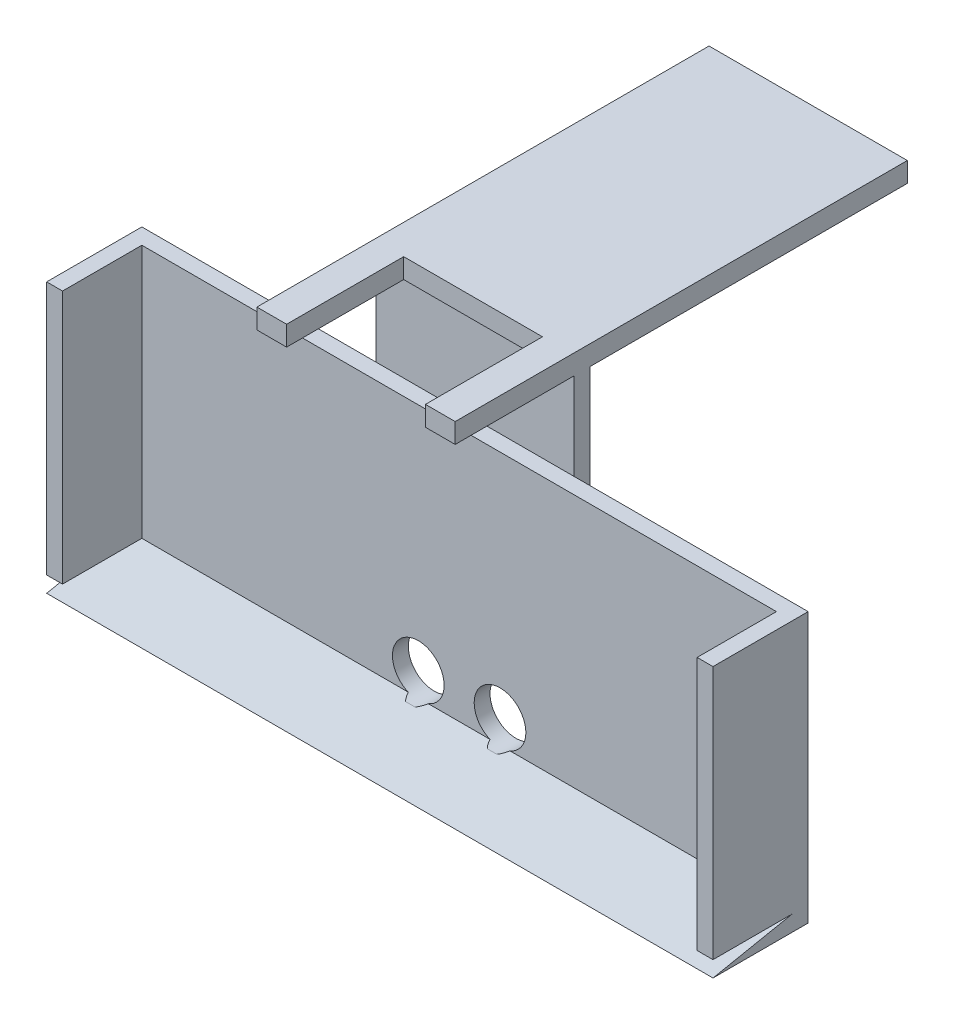
from build123d import *

# Parameters (mm, degrees)
SKETCH1_W               = 203.2
SKETCH1_H               = 25.4
BOSS_EXTRUDE1_DEPTH     = 5.08
BOSS_EXTRUDE2_DEPTH     = 5.08
SKETCH5_W               = 213.36
SKETCH5_H               = 86.36
BOSS_EXTRUDE3_DEPTH     = 5.08
CUT_EXTRUDE2_DEPTH      = 231.860710386
SKETCH7_W               = 63.5
SKETCH7_H               = 63.5
BOSS_EXTRUDE4_DEPTH     = 5.08
BOSS_EXTRUDE5_DEPTH     = 6.35
CUT_EXTRUDE3_REACH      = 205.537
SKETCH9_W               = 44.45
SKETCH9_H               = 58.324999377
CUT_EXTRUDE4_DEPTH      = 2.54
CUT_EXTRUDE4_DEPTH_BACK = 197.028932814
SKETCH10_R              = 8.2696685


with BuildPart() as part:
    # Sketch1 → Boss-Extrude1 (new body)
    with BuildSketch(Plane(origin=(0, 0, 0), x_dir=(1, 0, 0), z_dir=(0, 1, 0))):
        Rectangle(SKETCH1_W, SKETCH1_H)
    extrude(amount=BOSS_EXTRUDE1_DEPTH)

    # Sketch4 → Boss-Extrude2 (add)
    with BuildSketch(Plane(origin=(101.6, 0, 0), x_dir=(0, 0, -1), z_dir=(1, 0, 0))):
        Polygon((-12.7, 0), (-12.7, 5.08), (-12.7, 86.36), (12.7, 86.36), (12.7, 5.08), (12.7, 0), align=None)
    boss_extrude2 = extrude(amount=BOSS_EXTRUDE2_DEPTH)

    # Mirror1: Boss-Extrude2 across plane
    add(boss_extrude2.mirror(Plane(origin=(0, 0, 0), x_dir=(0, 0, 1), z_dir=(1, 0, 0))))

    # Sketch5 → Boss-Extrude3 (add)
    with BuildSketch(Plane(origin=(0, 0, -12.7), x_dir=(-1, 0, 0), z_dir=(0, 0, -1))):
        with Locations((0, 43.18)):
            Rectangle(SKETCH5_W, SKETCH5_H)
    extrude(amount=BOSS_EXTRUDE3_DEPTH)

    # Sketch6 → Cut-Extrude2 (cut, through all)
    with BuildSketch(Plane(origin=(106.68, 0, 0), x_dir=(0, 0, -1), z_dir=(1, 0, 0))):
        Polygon((-12.7, 0), (12.7, 5.08), (-12.7, 5.08), align=None)
    extrude(amount=-CUT_EXTRUDE2_DEPTH, mode=Mode.SUBTRACT)

    # Sketch7 → Boss-Extrude4 (add)
    with BuildSketch(Plane(origin=(0, 0, -17.78), x_dir=(-1, 0, 0), z_dir=(0, 0, -1))):
        with Locations((0, 82.55)):
            Rectangle(SKETCH7_W, SKETCH7_H)
    extrude(amount=BOSS_EXTRUDE4_DEPTH)

    # Sketch8 → Boss-Extrude5 (add)
    with BuildSketch(Plane(origin=(0, 114.3, 0), x_dir=(1, 0, 0), z_dir=(0, 1, 0))):
        Polygon((-31.75, 22.86), (-31.75, 124.46), (31.75, 124.46), (31.75, 22.86), (31.75, 17.78), (31.75, -20.32), (-31.75, -20.32), (-31.75, 17.78), align=None)
    extrude(amount=BOSS_EXTRUDE5_DEPTH)

    # Sketch9 → Cut-Extrude3 (cut, up to next)
    with BuildSketch(Plane(origin=(0, 120.65, 0), x_dir=(1, 0, 0), z_dir=(0, 1, 0)), mode=Mode.PRIVATE) as cut_extrude3_sk1:
        with Locations((0, -12.001142466)):
            Rectangle(SKETCH9_W, SKETCH9_H)
    cut_extrude3_tool1 = extrude(cut_extrude3_sk1.sketch, amount=-CUT_EXTRUDE3_REACH, mode=Mode.PRIVATE) & part.part
    add(cut_extrude3_tool1.solids().sort_by_distance((0, 120.65, 12.001142))[0], mode=Mode.SUBTRACT)

    # Sketch10 → Cut-Extrude4 (cut, two sides: drawn at the far end of the back side and taken through both)
    with BuildSketch(Plane.XY.offset(-12.7).offset(-CUT_EXTRUDE4_DEPTH_BACK)):
        with Locations((-13.081, 12.7)):
            Circle(SKETCH10_R)
        with Locations((13.081, 12.7)):
            Circle(SKETCH10_R)
    extrude(amount=CUT_EXTRUDE4_DEPTH + CUT_EXTRUDE4_DEPTH_BACK, mode=Mode.SUBTRACT)


solid = part.part
